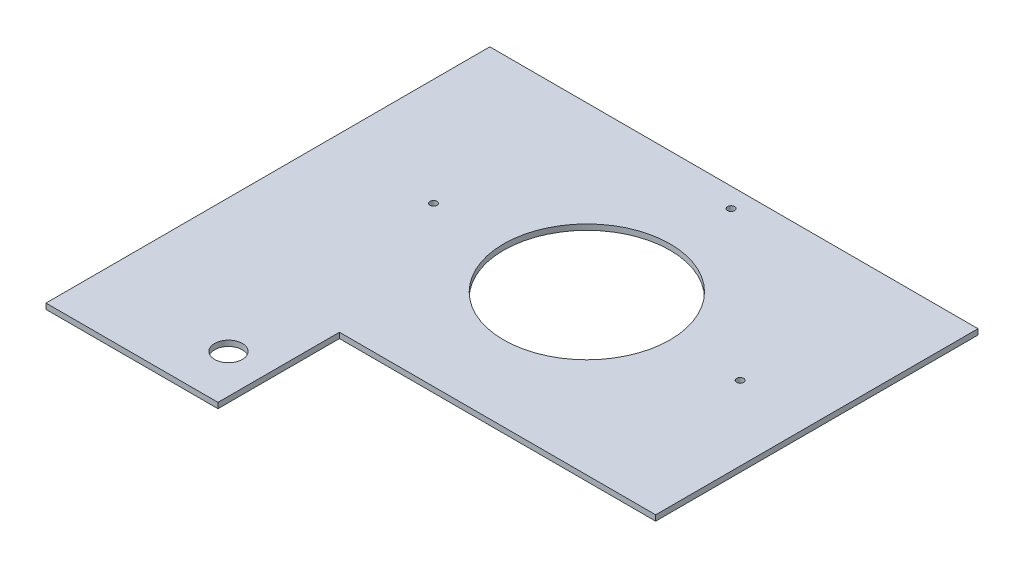
from build123d import *

# Parameters (mm, degrees)
CROQUIS2_R              = 75
CROQUIS2_R_2            = 3.175
CROQUIS2_R_3            = 12.5
SALIENTE_EXTRUIR2_DEPTH = 5


with BuildPart() as part:
    # Croquis2 → Saliente-Extruir2 (new body)
    with BuildSketch(Plane(origin=(0, 0, 0), x_dir=(1, 0, 0), z_dir=(0, 1, 0))):
        Polygon((-164.024069274, 177.568942162), (-164.024069274, -142.431057838), (-164.024069274, -189.256710106), (-164.024069274, -222.426710106), (-79.024069274, -222.426710106), (-9.024069274, -222.426710106), (-9.024069274, -112.958468136), (275.975930726, -112.958468136), (275.975930726, 177.568942162), align=None)
        with Locations((70.975930726, 30.02579809)):
            Circle(CROQUIS2_R, mode=Mode.SUBTRACT)
        with Locations((209.175930726, 30.02579809)):
            Circle(CROQUIS2_R_2, mode=Mode.SUBTRACT)
        with Locations((-67.224069274, 30.02579809)):
            Circle(CROQUIS2_R_2, mode=Mode.SUBTRACT)
        with Locations((70.975930726, 160.02579809)):
            Circle(CROQUIS2_R_2, mode=Mode.SUBTRACT)
        with Locations((-44.024069274, -177.958468136)):
            Circle(CROQUIS2_R_3, mode=Mode.SUBTRACT)
    extrude(amount=SALIENTE_EXTRUIR2_DEPTH)


solid = part.part
